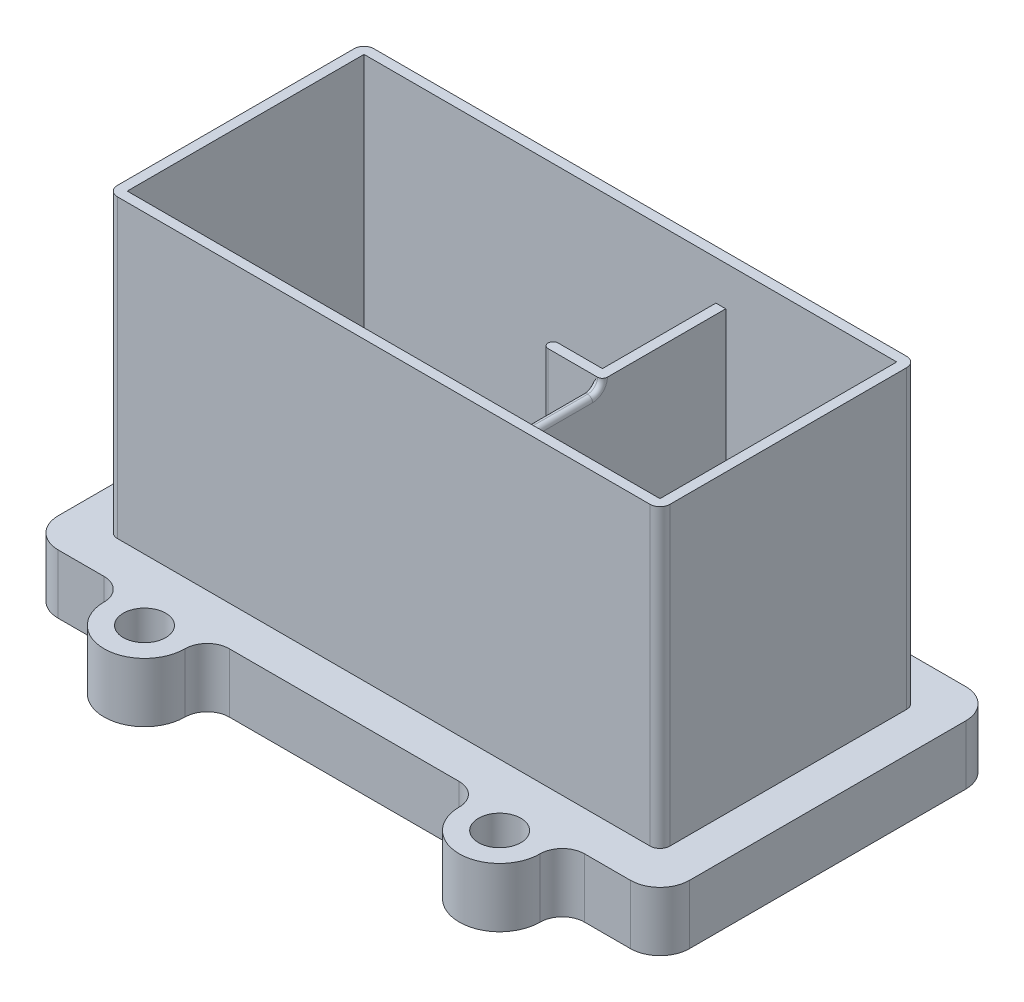
from build123d import *

# Parameters (mm, degrees)
BASE_PLATE_AND_PORTS_2_R   = 0.34999999999999903
BASE_PLATE_AND_PORTS_2_R_2 = 1.0749999999999997
BASE_PLATE_AND_PORTS_2_R_3 = 1.0749999999999986
BASE_PLATE_AND_PORTS_DEPTH = 1.5
BOSS_EXTRUDE1_DEPTH        = 15
RESERVOIRS_4_W             = 0.5000000000000018
RESERVOIRS_4_H             = 12.000000000000004
BOSS_EXTRUDE5_DEPTH        = 13
BOSS_EXTRUDE3_START        = 1.5
SKETCH3_W                  = 15.333333333333329
SKETCH3_H                  = 0.5
BOSS_EXTRUDE3_DEPTH        = 3
CUT_EXTRUDE1_REACH         = 27.893
BOSS_EXTRUDE6_DEPTH        = 14.5
CUT_EXTRUDE2_DEPTH         = 0.5
FILLET2_R                  = 0.25


with BuildPart() as part:
    # Base-plate and ports 2 → Base plate and ports (new, symmetric)
    with BuildSketch(Plane(origin=(0, 0, 0), x_dir=(1, 0, 0), z_dir=(0, 1, 0))):
        with BuildLine():
            Line((-15.999999999999996, -6.999999999999999), (-15.999999999999996, 6.999999999999999))
            ThreePointArc((-15.999999999999996, 6.999999999999999), (-15.56066017177982, 8.060660171779821), (-14.499999999999996, 8.5))
            Line((-14.499999999999996, 8.5), (-3.1749999999999976, 8.5))
            ThreePointArc((-3.1749999999999976, 8.5), (-2.379504871165132, 8.829504871165135), (-2.049999999999998, 9.625000000000002))
            ThreePointArc((-2.049999999999998, 9.625000000000002), (1.86e-15, 11.675), (2.0500000000000016, 9.625000000000002))
            ThreePointArc((2.0500000000000016, 9.625000000000002), (2.379504871165136, 8.829504871165135), (3.1750000000000025, 8.5))
            Line((3.1750000000000025, 8.5), (14.499999999999996, 8.5))
            ThreePointArc((14.499999999999996, 8.5), (15.560660171779821, 8.060660171779823), (16, 6.999999999999999))
            Line((16, 6.999999999999999), (15.999999999999996, -6.999999999999999))
            ThreePointArc((15.999999999999996, -6.999999999999999), (15.56066017177982, -8.060660171779821), (14.499999999999996, -8.5))
            Line((14.499999999999996, -8.5), (12.175, -8.5))
            ThreePointArc((12.175, -8.5), (11.379504871165134, -8.829504871165135), (11.049999999999999, -9.625000000000002))
            ThreePointArc((11.049999999999999, -9.625000000000002), (9, -11.675000000000002), (6.949999999999999, -9.625000000000002))
            ThreePointArc((6.949999999999999, -9.625000000000002), (6.620495128834865, -8.829504871165135), (5.8249999999999975, -8.5))
            Line((5.8249999999999975, -8.5), (-5.8249999999999975, -8.5))
            ThreePointArc((-5.8249999999999975, -8.5), (-6.620495128834865, -8.829504871165135), (-6.949999999999999, -9.625000000000002))
            ThreePointArc((-6.949999999999999, -9.625000000000002), (-9, -11.675), (-11.049999999999999, -9.625000000000002))
            ThreePointArc((-11.049999999999999, -9.625000000000002), (-11.379504871165134, -8.829504871165135), (-12.175, -8.5))
            Line((-12.175, -8.5), (-14.499999999999996, -8.5))
            ThreePointArc((-14.499999999999996, -8.5), (-15.560660171779817, -8.060660171779821), (-15.999999999999996, -6.999999999999999))
        make_face()
        with Locations(Location((-10.499999999999995, 2.999999999999999, 0), (0, 0, 270))):
            Circle(BASE_PLATE_AND_PORTS_2_R, mode=Mode.SUBTRACT)
        with Locations(Location((10.500000000000005, 2.999999999999999, 0), (0, 0, 270))):
            Circle(BASE_PLATE_AND_PORTS_2_R, mode=Mode.SUBTRACT)
        with Locations(Location((10.500000000000005, -3.000000000000001, 0), (0, 0, 270))):
            Circle(BASE_PLATE_AND_PORTS_2_R, mode=Mode.SUBTRACT)
        with Locations(Location((-10.499999999999995, -3.000000000000001, 0), (0, 0, 270))):
            Circle(BASE_PLATE_AND_PORTS_2_R, mode=Mode.SUBTRACT)
        with Locations(Location((1.73e-15, 9.625000000000002, 0), (0, 0, 270))):
            Circle(BASE_PLATE_AND_PORTS_2_R_2, mode=Mode.SUBTRACT)
        with Locations(Location((-9, -9.625000000000002, 0), (0, 0, 270))):
            Circle(BASE_PLATE_AND_PORTS_2_R_3, mode=Mode.SUBTRACT)
        with Locations(Location((9, -9.625000000000002, 0), (0, 0, 270))):
            Circle(BASE_PLATE_AND_PORTS_2_R_3, mode=Mode.SUBTRACT)
    extrude(amount=BASE_PLATE_AND_PORTS_DEPTH, both=True)

    # Reservoirs → Boss-Extrude1 (add)
    with BuildSketch(Plane(origin=(0, 1.5, 0), x_dir=(1, 0, 0), z_dir=(0, 1, 0))):
        with BuildLine():
            ThreePointArc((-13.999999999999998, -5.999999999999997), (-13.853553390593273, -6.353553390593276), (-13.499999999999995, -6.500000000000002))
            Line((-13.499999999999995, -6.500000000000002), (13.499999999999995, -6.500000000000002))
            ThreePointArc((13.499999999999995, -6.500000000000002), (13.853553390593273, -6.353553390593276), (13.999999999999998, -5.999999999999997))
            Line((13.999999999999998, -5.999999999999997), (13.999999999999998, 5.999999999999999))
            ThreePointArc((13.999999999999998, 5.999999999999998), (13.853553390593271, 6.353553390593275), (13.499999999999995, 6.500000000000001))
            Line((13.499999999999995, 6.500000000000002), (-13.499999999999995, 6.500000000000002))
            ThreePointArc((-13.499999999999995, 6.500000000000001), (-13.853553390593271, 6.353553390593275), (-13.999999999999998, 5.999999999999998))
            Line((-13.999999999999998, 5.999999999999999), (-13.999999999999998, -5.999999999999997))
        make_face()
        Polygon((4.333333333333331, -6.000000000000002), (-4.333333333333333, -6.000000000000002), (-4.833333333333332, -6.000000000000002), (-13.499999999999996, -6.000000000000002), (-13.499999999999996, 6.000000000000002), (-4.833333333333332, 6.000000000000002), (-4.333333333333333, 6.000000000000002), (4.333333333333331, 6.000000000000002), (4.833333333333334, 6.000000000000002), (13.499999999999998, 6.000000000000002), (13.499999999999998, -6.000000000000002), (4.833333333333334, -6.000000000000002), align=None, mode=Mode.SUBTRACT)
    extrude(amount=BOSS_EXTRUDE1_DEPTH)

    # Reservoirs<4> → Boss-Extrude5 (add)
    with BuildSketch(Plane(origin=(0, 1.5, 0), x_dir=(1, 0, 0), z_dir=(0, 1, 0))):
        with Locations((4.583333333333333, 0)):
            Rectangle(RESERVOIRS_4_W, RESERVOIRS_4_H)
    extrude(amount=BOSS_EXTRUDE5_DEPTH)

    # Sketch3 → Boss-Extrude3 (add)
    with BuildSketch(Plane(origin=(0, 0, 0), x_dir=(1, 0, 0), z_dir=(0, 1, 0)).offset(BOSS_EXTRUDE3_START)):
        with Locations((-5.833333333333332, 0)):
            Rectangle(SKETCH3_W, SKETCH3_H)
        Polygon((4.333333333333332, 0.25), (1.8333333333333321, 0.25), (1.8333333333333326, -0.25), (4.333333333333332, -0.25), align=None)
    extrude(amount=BOSS_EXTRUDE3_DEPTH)

    # Sketch4 → Cut-Extrude1 (cut, up to next)
    with BuildSketch(Plane.XY.offset(0.25), mode=Mode.PRIVATE) as cut_extrude1_sk1:
        with BuildLine():
            Line((-13.499999999999995, 4), (1.3333333333333304, 4))
            ThreePointArc((1.3333333333333304, 3.9999999999999996), (1.8333333333333313, 4.5), (1.3333333333333304, 5.000000000000001))
            Line((1.3333333333333304, 5.000000000000001), (-13.499999999999995, 5.000000000000001))
            Line((-13.499999999999995, 5.000000000000001), (-13.499999999999995, 4))
        make_face()
    cut_extrude1_tool1 = extrude(cut_extrude1_sk1.sketch, amount=-CUT_EXTRUDE1_REACH, mode=Mode.PRIVATE) & part.part
    add(cut_extrude1_tool1.solids().sort_by_distance((-5.886575, 4.5, 0.25))[0], mode=Mode.SUBTRACT)

    # Sketch3<4> → Boss-Extrude6 (add)
    with BuildSketch(Plane(origin=(0, 0, 0), x_dir=(1, 0, 0), z_dir=(0, 1, 0))):
        Polygon((4.333333333333332, 0.25), (1.8333333333333321, 0.25), (1.8333333333333326, -0.25), (4.333333333333332, -0.25), align=None)
    extrude(amount=BOSS_EXTRUDE6_DEPTH)

    # Sketch5 → Cut-Extrude2 (cut)
    with BuildSketch(Plane(origin=(4.833333333333334, 0, 0), x_dir=(0, 0, -1), z_dir=(1, 0, 0))):
        with BuildLine():
            Line((-0.25, 14.5), (-6.000000000000002, 14.5))
            ThreePointArc((-6.000000000000001, 14.5), (-5.853553390593275, 14.146446609406727), (-5.500000000000002, 14))
            Line((-5.500000000000002, 14.000000000000002), (-0.75, 14.000000000000002))
            ThreePointArc((-0.7500000000000004, 14), (-0.39644660940672805, 14.146446609406727), (-0.2500000000000025, 14.5))
        make_face()
        with BuildLine():
            Line((-0.75, 15), (-5.500000000000002, 15))
            ThreePointArc((-5.500000000000002, 15), (-5.853553390593275, 14.853553390593273), (-6.000000000000001, 14.5))
            Line((-6.000000000000002, 14.5), (-0.25, 14.5))
            ThreePointArc((-0.2500000000000025, 14.5), (-0.396446609406728, 14.853553390593273), (-0.7500000000000003, 15))
        make_face()
        with BuildLine():
            ThreePointArc((-6.000000000000001, 14.5), (-5.853553390593275, 14.853553390593273), (-5.500000000000002, 15))
            Line((-5.500000000000002, 15), (-0.75, 15))
            ThreePointArc((-0.7500000000000003, 15), (-0.396446609406728, 14.853553390593273), (-0.2500000000000025, 14.5))
            Line((-0.25, 14.5), (-0.2500000000000011, 16.5))
            Line((-0.2500000000000009, 16.5), (-6.000000000000002, 16.5))
            Line((-6.000000000000002, 16.5), (-6.000000000000002, 14.5))
        make_face()
    extrude(amount=-CUT_EXTRUDE2_DEPTH, mode=Mode.SUBTRACT)

    # Fillet2
    # the kernel refuses this fillet: 0.25 mm, written as the material it takes off along each edge
    with BuildSketch(Plane(origin=(4.833333333333334, 14.500000000000002, 5.5), x_dir=(0, -1, 3.55e-15), z_dir=(0, -3.55e-15, -1))) as fillet2_piece_1_section:
        with BuildLine():
            CenterArc((0.5000000000000018 + FILLET2_R, FILLET2_R), FILLET2_R, 180, 90)
            Line((0.5000000000000018, FILLET2_R), (0.5000000000000018, 0))
            Line((0.5000000000000018, 0), (0.5000000000000018 + FILLET2_R, 0))
        make_face()
    fillet2_piece_1 = revolve(axis=Axis((4.833333333333334, 14.500000000000002, 5.5), (-1, 0, 0)), revolution_arc=161.64849461869665, mode=Mode.PRIVATE)
    fillet2_piece_1 = split(fillet2_piece_1, bisect_by=Plane(origin=(4.792673642292299, 13.946974301999488, 6.000000000000002), z_dir=(0, 0, -1)), keep=Keep.TOP, mode=Mode.PRIVATE)
    add(fillet2_piece_1, mode=Mode.SUBTRACT)
    with BuildSketch(Plane(origin=(4.833333333333334, 14.5, 0.7500000000000024), x_dir=(0, -1, -4.44e-15), z_dir=(0, -4.44e-15, 1))) as fillet2_piece_2:
        with BuildLine():
            CenterArc((0.5 + FILLET2_R, -FILLET2_R), FILLET2_R, 90, 90)
            Line((0.5, -FILLET2_R), (0.5, 0))
            Line((0.5, 0), (0.5 + FILLET2_R, 0))
        make_face()
    revolve(axis=Axis((4.833333333333334, 14.5, 0.7500000000000024), (1, 0, 0)), revolution_arc=161.64849461869707, mode=Mode.SUBTRACT)
    with BuildSketch(Plane(origin=(4.333333333333334, 14.499999999999998, 5.5), x_dir=(0, 0.9491428341660831, 0.31484580408697754), z_dir=(0, 0.31484580408697754, -0.9491428341660831))) as fillet2_piece_3_section:
        with BuildLine():
            CenterArc((0.5000000000000034 + FILLET2_R, FILLET2_R), FILLET2_R, 180, 90)
            Line((0.5000000000000034, FILLET2_R), (0.5000000000000034, -1.78e-15))
            Line((0.5000000000000034, -1.78e-15), (0.5000000000000034 + FILLET2_R, -1.78e-15))
        make_face()
    fillet2_piece_3 = revolve(axis=Axis((4.333333333333334, 14.499999999999998, 5.5), (1, 0, 0)), revolution_arc=161.64849461869707, mode=Mode.PRIVATE)
    fillet2_piece_3 = split(fillet2_piece_3, bisect_by=Plane(origin=(4.401371141289412, 14.134450790622495, 6.000000000000002), z_dir=(0, 0, -1)), keep=Keep.TOP, mode=Mode.PRIVATE)
    add(fillet2_piece_3, mode=Mode.SUBTRACT)
    with BuildSketch(Plane(origin=(4.333333333333334, 14.5, 0.7500000000000024), x_dir=(0, 0.9491428341660829, -0.31484580408697815), z_dir=(0, 0.31484580408697815, 0.9491428341660829))) as fillet2_piece_4_section:
        with BuildLine():
            CenterArc((0.4999999999999997 + FILLET2_R, -FILLET2_R), FILLET2_R, 90, 90)
            Line((0.4999999999999998, -FILLET2_R), (0.4999999999999997, 1.78e-15))
            Line((0.4999999999999997, 1.78e-15), (0.4999999999999997 + FILLET2_R, 1.78e-15))
        make_face()
    fillet2_piece_4 = revolve(axis=Axis((4.333333333333334, 14.5, 0.7500000000000024), (-1, 0, 0)), revolution_arc=161.64849461869707, mode=Mode.PRIVATE)
    fillet2_piece_4 = split(fillet2_piece_4, bisect_by=Plane(origin=(4.401371052890266, 14.134450871255241, 0.25), z_dir=(0, 0, 1)), keep=Keep.TOP, mode=Mode.PRIVATE)
    add(fillet2_piece_4, mode=Mode.SUBTRACT)
    with BuildSketch(Plane(origin=(4.833333333333334, 14.000000000000002, 5.500000000000002), x_dir=(0, -1, 0), z_dir=(0, 0, -1))) as fillet2_piece_5:
        with BuildLine():
            CenterArc((FILLET2_R, FILLET2_R), FILLET2_R, 180, 90)
            Line((0, FILLET2_R), (0, 0))
            Line((0, 0), (FILLET2_R, 0))
        make_face()
    extrude(amount=4.750000000000002, mode=Mode.SUBTRACT)
    with BuildSketch(Plane(origin=(4.333333333333334, 14.000000000000002, 5.500000000000002), x_dir=(-7.11e-15, -1, 0), z_dir=(0, 0, -1))) as fillet2_piece_6:
        with BuildLine():
            CenterArc((FILLET2_R, -FILLET2_R), FILLET2_R, 89.99999999999959, 90.00000000000041)
            Line((-1.78e-15, -FILLET2_R), (0, 0))
            Line((0, 0), (FILLET2_R, 0))
        make_face()
    extrude(amount=4.750000000000002, mode=Mode.SUBTRACT)
    with BuildSketch(Plane(origin=(1.8333333333333324, 4.4999999999999805, 0.25), x_dir=(1, 0, 0), z_dir=(0, 1, 0))) as fillet2_piece_7:
        with BuildLine():
            CenterArc((FILLET2_R, FILLET2_R), FILLET2_R, 180, 90)
            Line((-2.2e-16, FILLET2_R), (0, 0))
            Line((0, 0), (FILLET2_R, 0))
        make_face()
    extrude(amount=10.625000000000018, mode=Mode.SUBTRACT)
    with BuildSketch(Plane(origin=(1.3333333333333308, 4.5, 0.25), x_dir=(-8.9e-16, -1, 0), z_dir=(-1, 8.9e-16, 0))) as fillet2_piece_8:
        with BuildLine():
            CenterArc((0.5000000000000004 + FILLET2_R, -FILLET2_R), FILLET2_R, 90, 90)
            Line((0.5000000000000004, -FILLET2_R), (0.5000000000000004, 0))
            Line((0.5000000000000004, 0), (0.5000000000000004 + FILLET2_R, 0))
        make_face()
    revolve(axis=Axis((1.3333333333333308, 4.5, 0.25), (0, 0, 1)), revolution_arc=89.99999999999781, mode=Mode.SUBTRACT)
    with BuildSketch(Plane(origin=(1.8333333333333324, 4.5, -0.25), x_dir=(8.9e-16, 0, 1), z_dir=(0, 1, 0))) as fillet2_piece_9:
        with BuildLine():
            CenterArc((FILLET2_R, FILLET2_R), FILLET2_R, 180.00000000000006, 89.99999999999989)
            Line((2.2e-16, FILLET2_R), (0, 0))
            Line((0, 0), (FILLET2_R, 0))
        make_face()
    extrude(amount=10.625, mode=Mode.SUBTRACT)
    with BuildSketch(Plane(origin=(1.3333333333333308, 4.5, -0.25), x_dir=(-8.9e-16, -1, 0), z_dir=(-1, 8.9e-16, 0))) as fillet2_piece_10:
        with BuildLine():
            CenterArc((0.5000000000000004 + FILLET2_R, FILLET2_R), FILLET2_R, 180, 90)
            Line((0.5000000000000004 + FILLET2_R, 0), (0.5000000000000004, 0))
            Line((0.5000000000000004, 0), (0.5000000000000004, FILLET2_R))
        make_face()
    revolve(axis=Axis((1.3333333333333308, 4.5, -0.25), (0, 0, 1)), revolution_arc=90.00000000000006, mode=Mode.SUBTRACT)
    with BuildSketch(Plane(origin=(-13.499999999999995, 4, 0.25), x_dir=(0, -1, 0), z_dir=(1, 0, 0))) as fillet2_piece_11:
        with BuildLine():
            CenterArc((FILLET2_R, FILLET2_R), FILLET2_R, 180, 90)
            Line((0, FILLET2_R), (0, 0))
            Line((0, 0), (FILLET2_R, 0))
        make_face()
    extrude(amount=14.833333333333325, mode=Mode.SUBTRACT)
    with BuildSketch(Plane(origin=(1.3333333333333304, 4, -0.25), x_dir=(0, 0, 1), z_dir=(-1, 0, 0))) as fillet2_piece_12:
        with BuildLine():
            CenterArc((FILLET2_R, -FILLET2_R), FILLET2_R, 90, 90)
            Line((0, -FILLET2_R), (0, 0))
            Line((0, 0), (FILLET2_R, 0))
        make_face()
    extrude(amount=14.833333333333325, mode=Mode.SUBTRACT)


solid = part.part
